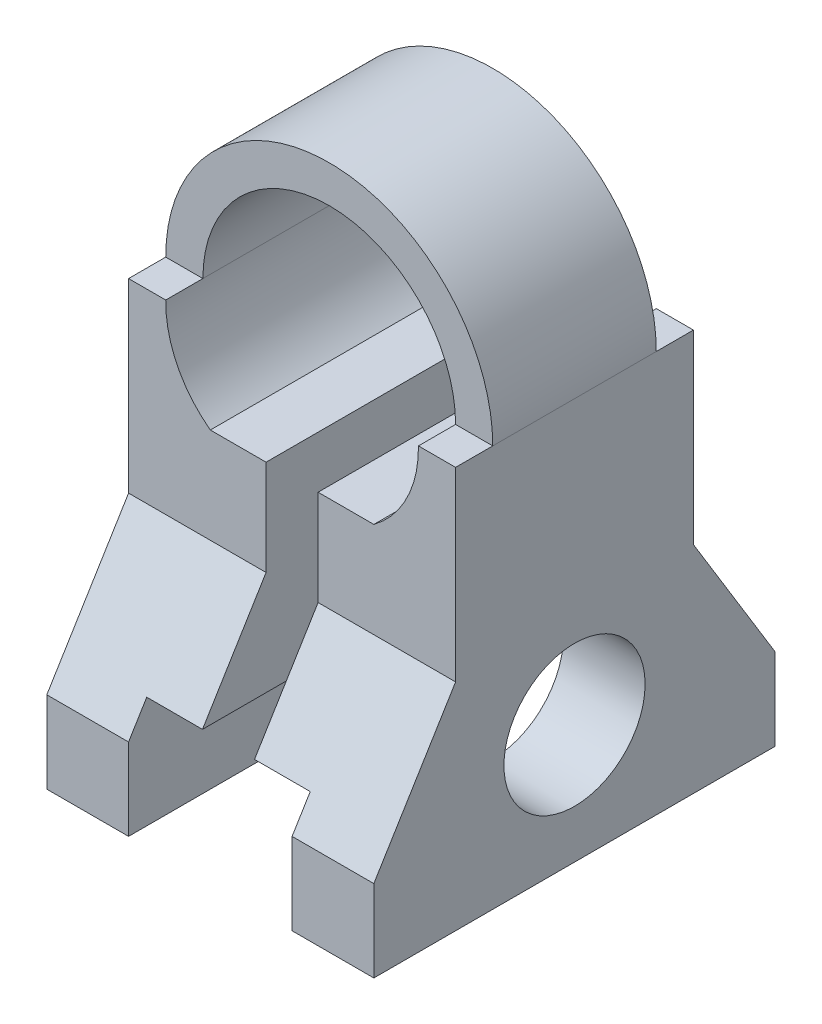
from build123d import *

# Parameters (mm, degrees)
BOSS_EXTRUDE1_DEPTH = 11
BOSS_EXTRUDE2_DEPTH = 7.5
CUT_EXTRUDE1_DEPTH  = 32
SKETCH7_W           = 7.5
SKETCH7_H           = 12.852731308
BOSS_EXTRUDE4_DEPTH = 32
BOSS_EXTRUDE5_DEPTH = 22
SKETCH10_R          = 9.5
CUT_EXTRUDE2_DEPTH  = 93.431147689


with BuildPart() as part:
    # Sketch1 → Boss-Extrude1 (new body)
    with BuildSketch(Plane(origin=(0, 0, 0), x_dir=(0, 0, -1), z_dir=(1, 0, 0))):
        Polygon((-28.836040694, 0), (-28.836040694, 11), (-17.836040694, 29), (-17.836040694, 54), (14.163959306, 54), (14.163959306, 29), (25.163959306, 11), (25.163959306, 0), align=None)
    extrude(amount=-BOSS_EXTRUDE1_DEPTH)

    # Sketch3 → Boss-Extrude2 (add)
    with BuildSketch(Plane.ZY.offset(11)):
        Polygon((-14.163959306, 29), (17.836040694, 29), (26.39159625, 15), (-22.719514861, 15), align=None)
    extrude(amount=BOSS_EXTRUDE2_DEPTH)

    # Sketch6 → Cut-Extrude1 (cut)
    with BuildSketch(Plane.XY.offset(17.836040694)):
        with BuildLine():
            Line((-11, 54), (-11, 41.852731308))
            ThreePointArc((-11, 41.852731308), (-6.531319585, 47.200928297), (-5, 54))
            Line((-5, 54), (-11, 54))
        make_face()
    extrude(amount=-CUT_EXTRUDE1_DEPTH, mode=Mode.SUBTRACT)

    # Sketch7 → Boss-Extrude4 (add)
    with BuildSketch(Plane.XY.offset(17.836040694)):
        with Locations((-14.75, 35.426365654)):
            Rectangle(SKETCH7_W, SKETCH7_H)
    extrude(amount=-BOSS_EXTRUDE4_DEPTH)


with BuildPart() as body_2:
    # Mirror3: mirrored copy
    add(part.part.mirror(Plane.ZY.offset(22)))


with BuildPart() as part_1:
    add(part.part)

    add(body_2.part)  # Boss-Extrude5 merges body 2
    # Sketch9 → Boss-Extrude5 (add)
    with BuildSketch(Plane.XY.offset(12.836040694)):
        with BuildLine():
            Line((-44, 54), (-39, 54))
            ThreePointArc((-39, 54), (-22, 70.999998817), (-5, 54))
            Line((-5, 54), (0, 54))
            ThreePointArc((0, 54), (-22, 75.999998817), (-44, 54))
        make_face()
    extrude(amount=-BOSS_EXTRUDE5_DEPTH)

    # Sketch10 → Cut-Extrude2 (cut, through all)
    with BuildSketch(Plane(origin=(0, 0, 0), x_dir=(0, 0, -1), z_dir=(1, 0, 0))):
        with Locations((-1.836040694, 16)):
            Circle(SKETCH10_R)
    extrude(amount=-CUT_EXTRUDE2_DEPTH, mode=Mode.SUBTRACT)


solid = part_1.part
